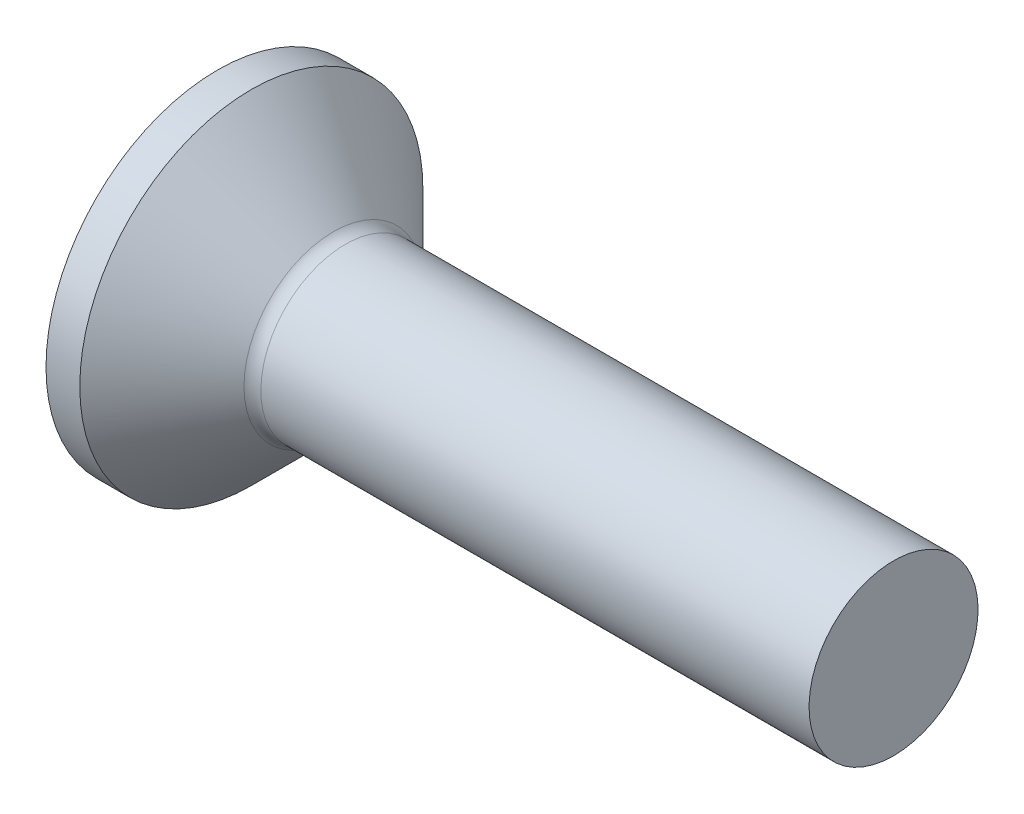
from build123d import *

# Parameters (mm, degrees)
FILLET1_R = 0.1


with BuildPart() as part:
    # Sketch1 → Base-Revolve (revolve)
    with BuildSketch(Plane(origin=(-0.4925, -1.5075, 0), x_dir=(0, 1, 0), z_dir=(0, 0, 1))):
        Polygon((1.5075, -0.4925), (2.5225, -0.4925), (2.5225, -0.6925), (2.0075, -1.2075), (2.0075, -4.4925), (1.5075, -4.4925), align=None)
    revolve(axis=Axis((-2.5225, 0, 0), (1, 0, 0)))

    # Fillet1
    fillet1_edges = [part.edges().sort_by_distance(p)[0] for p in [
        (0.715, -0.5, 0),
    ]]
    fillet(fillet1_edges, radius=FILLET1_R)


solid = part.part
